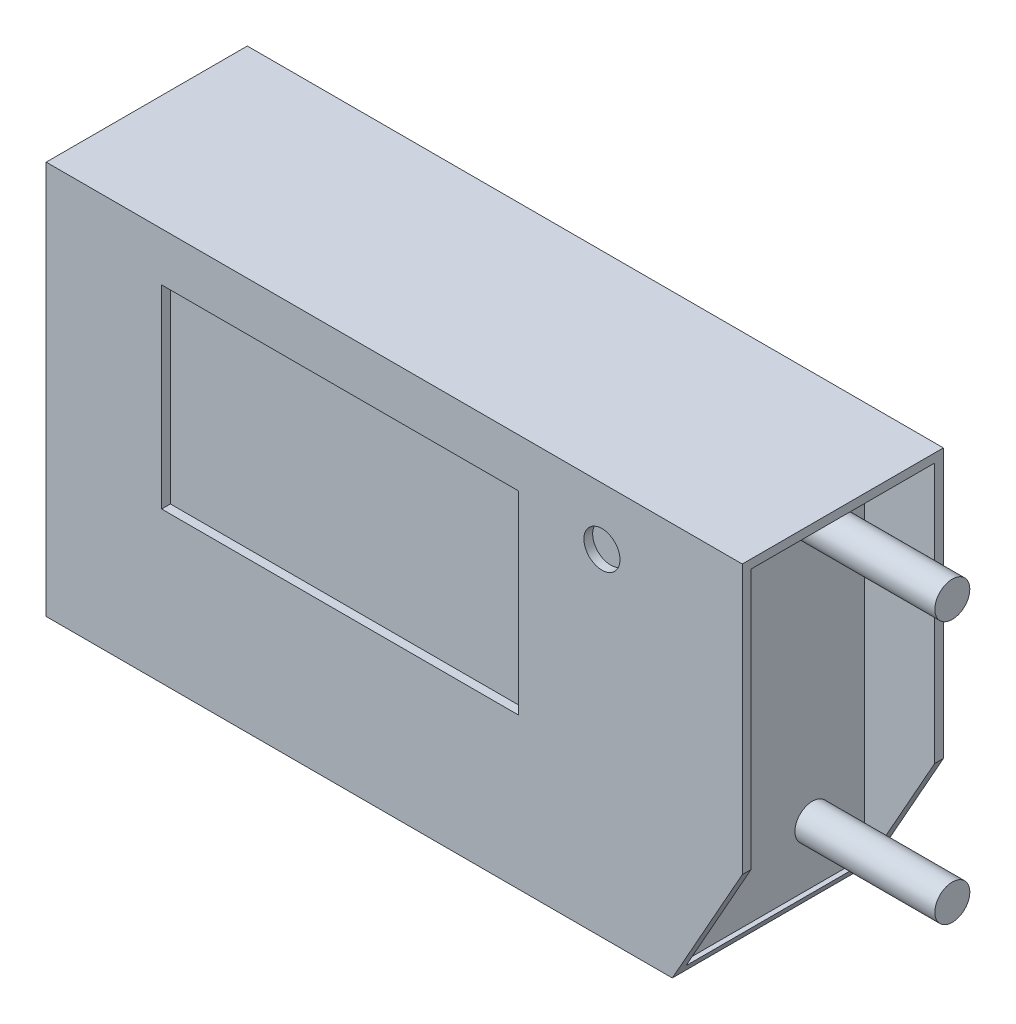
from build123d import *

# Parameters (mm, degrees)
SKETCH1_W           = 42
SKETCH1_H           = 22.5
BOSS_EXTRUDE1_DEPTH = 5.75
SKETCH2_W           = 10.5
SKETCH2_H           = 21.5
CUT_EXTRUDE1_DEPTH  = 4
CUT_EXTRUDE3_DEPTH  = 27.453969456
SKETCH8_W           = 2.2
SKETCH8_H           = 22.5
CUT_EXTRUDE4_DEPTH  = 27.453969456
SKETCH3_R           = 1
BOSS_EXTRUDE2_DEPTH = 8
SKETCH4_R           = 0.5
BOSS_EXTRUDE3_DEPTH = 8
SKETCH5_R           = 1.030633651
SKETCH5_W           = 20.392034512
SKETCH5_H           = 11.098868447
CUT_EXTRUDE2_DEPTH  = 0.5


with BuildPart() as part:
    # Sketch1 → Boss-Extrude1 (new, symmetric)
    with BuildSketch(Plane.XY):
        Rectangle(SKETCH1_W, SKETCH1_H)
    extrude(amount=BOSS_EXTRUDE1_DEPTH, both=True)

    # Sketch2 → Cut-Extrude1 (cut)
    with BuildSketch(Plane(origin=(21, 0, 0), x_dir=(0, 0, -1), z_dir=(1, 0, 0))):
        Rectangle(SKETCH2_W, SKETCH2_H)
    cut_extrude1 = extrude(amount=-CUT_EXTRUDE1_DEPTH, mode=Mode.SUBTRACT)

    # Mirror1: Cut-Extrude1 across plane
    add(cut_extrude1.mirror(Plane(origin=(0, 0, 0), x_dir=(0, 0, 1), z_dir=(1, 0, 0))), mode=Mode.SUBTRACT)

    # Sketch7 → Cut-Extrude3 (cut, through all)
    with BuildSketch(Plane.XY.offset(-5.75)):
        Polygon((24.167892902, -4.130649904), (21, -4.130649904), (17, -11.25), (17, -14.180704283), (24.167892902, -14.180704283), align=None)
    extrude(amount=CUT_EXTRUDE3_DEPTH, mode=Mode.SUBTRACT)

    # Sketch8 → Cut-Extrude4 (cut, through all)
    with BuildSketch(Plane.XY.offset(5.75)):
        with Locations((-19.9, 0)):
            Rectangle(SKETCH8_W, SKETCH8_H)
    extrude(amount=-CUT_EXTRUDE4_DEPTH, mode=Mode.SUBTRACT)

    # Sketch3 → Boss-Extrude2 (add)
    with BuildSketch(Plane(origin=(17, 0, 0), x_dir=(0, 0, -1), z_dir=(1, 0, 0))):
        with Locations((2.259944465, 7.5)):
            Circle(SKETCH3_R)
        with Locations((2.259944465, -7.5)):
            Circle(SKETCH3_R)
    extrude(amount=BOSS_EXTRUDE2_DEPTH)

    # Sketch4 → Boss-Extrude3 (add)
    with BuildSketch(Plane.ZY.offset(17)):
        with Locations((-3.364806204, 2.988148793)):
            Circle(SKETCH4_R)
        with Locations((-3.364806204, -2.988148793)):
            Circle(SKETCH4_R)
    extrude(amount=BOSS_EXTRUDE3_DEPTH)

    # Sketch5 → Cut-Extrude2 (cut)
    with BuildSketch(Plane.XY.offset(5.75)):
        with Locations((12.976825893, 7.964601522)):
            Circle(SKETCH5_R)
        with Locations((-2.003815564, 2.9231166)):
            Rectangle(SKETCH5_W, SKETCH5_H)
    extrude(amount=-CUT_EXTRUDE2_DEPTH, mode=Mode.SUBTRACT)


solid = part.part
